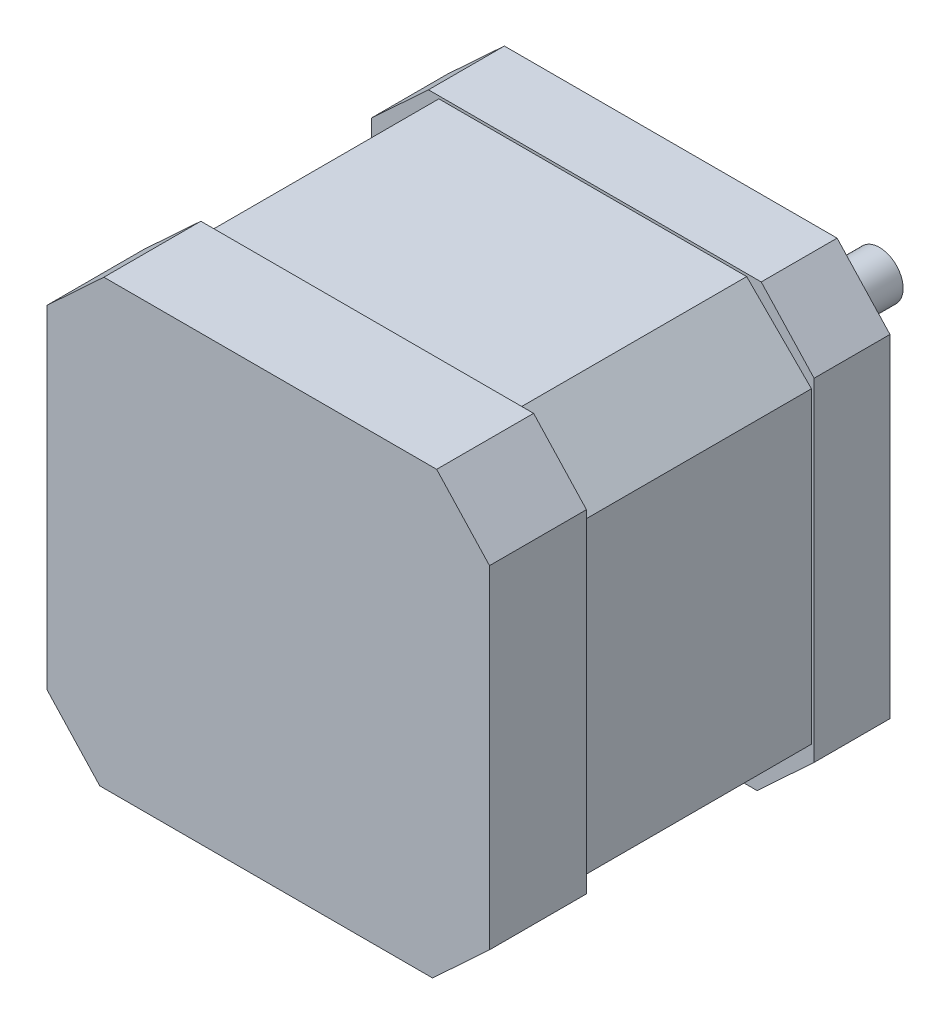
from build123d import *

# Parameters (mm, degrees)
RESSALTO_EXTRUS_O1_DEPTH   = 38
CORTE_EXTRUS_O_FINA1_START = -30.8
CORTE_EXTRUS_O_FINA1_DEPTH = 21.6
ESBO_O3_R                  = 2.25
RESSALTO_EXTRUS_O2_DEPTH   = 20
ESBO_O4_R                  = 10
RESSALTO_EXTRUS_O3_DEPTH   = 2
ESBO_O5_R                  = 1.5
CORTE_EXTRUS_O1_DEPTH      = 10


# Read off the part's stored shape, not the designer's step: Corte-Extrusão-Fina1
with BuildPart() as part:
    # Esboço1 → Ressalto-extrusão1 (new body)
    with BuildSketch(Plane.XY):
        Polygon((-21, -15.592171873), (-15.984175996, -21), (15.592171873, -21), (21, -15.984175996), (21, 15.592171873), (15.984175996, 21), (-15.592171873, 21), (-21, 15.984175996), align=None)
    extrude(amount=RESSALTO_EXTRUS_O1_DEPTH)

    # Corte-Extrusão-Fina1 outline → Corte-Extrusão-Fina1 (cut)
    with BuildSketch(Plane.XY.offset(38).offset(CORTE_EXTRUS_O_FINA1_START)):
        Polygon((15.592171873, -21), (21, -15.984175996), (21, 15.592171873), (15.984175996, 21), (-15.592171873, 21), (-21, 15.984175996), (-21, -15.592171873), (-15.984175996, -21), align=None)
        Polygon((14.605339059, 20.75), (20.75, 14.605339059), (20.75, -14.605339059), (14.605339059, -20.75), (-14.605339059, -20.75), (-20.75, -14.605339059), (-20.75, 14.605339059), (-14.605339059, 20.75), align=None, mode=Mode.SUBTRACT)
    extrude(amount=CORTE_EXTRUS_O_FINA1_DEPTH, mode=Mode.SUBTRACT)

    # Esboço3 → Ressalto-extrusão2 (add)
    with BuildSketch(Plane(origin=(0, 0, 0), x_dir=(-1, 0, 0), z_dir=(0, 0, -1))):
        with Locations(Location((0, 0, 0), (0, 0, 180))):
            Circle(ESBO_O3_R)
    extrude(amount=RESSALTO_EXTRUS_O2_DEPTH)

    # Esboço4 → Ressalto-extrusão3 (add)
    with BuildSketch(Plane(origin=(0, 0, 0), x_dir=(-1, 0, 0), z_dir=(0, 0, -1))):
        with Locations(Location((0, 0, 0), (0, 0, 180))):
            Circle(ESBO_O4_R)
    extrude(amount=RESSALTO_EXTRUS_O3_DEPTH)

    # Esboço5 → Corte-extrusão1 (cut)
    with BuildSketch(Plane(origin=(0, 0, 0), x_dir=(-1, 0, 0), z_dir=(0, 0, -1))):
        with Locations((15.5, -15.5)):
            Circle(ESBO_O5_R)
        with Locations((-15.5, -15.5)):
            Circle(ESBO_O5_R)
        with Locations((-15.5, 15.5)):
            Circle(ESBO_O5_R)
        with Locations((15.5, 15.5)):
            Circle(ESBO_O5_R)
    extrude(amount=-CORTE_EXTRUS_O1_DEPTH, mode=Mode.SUBTRACT)


solid = part.part
